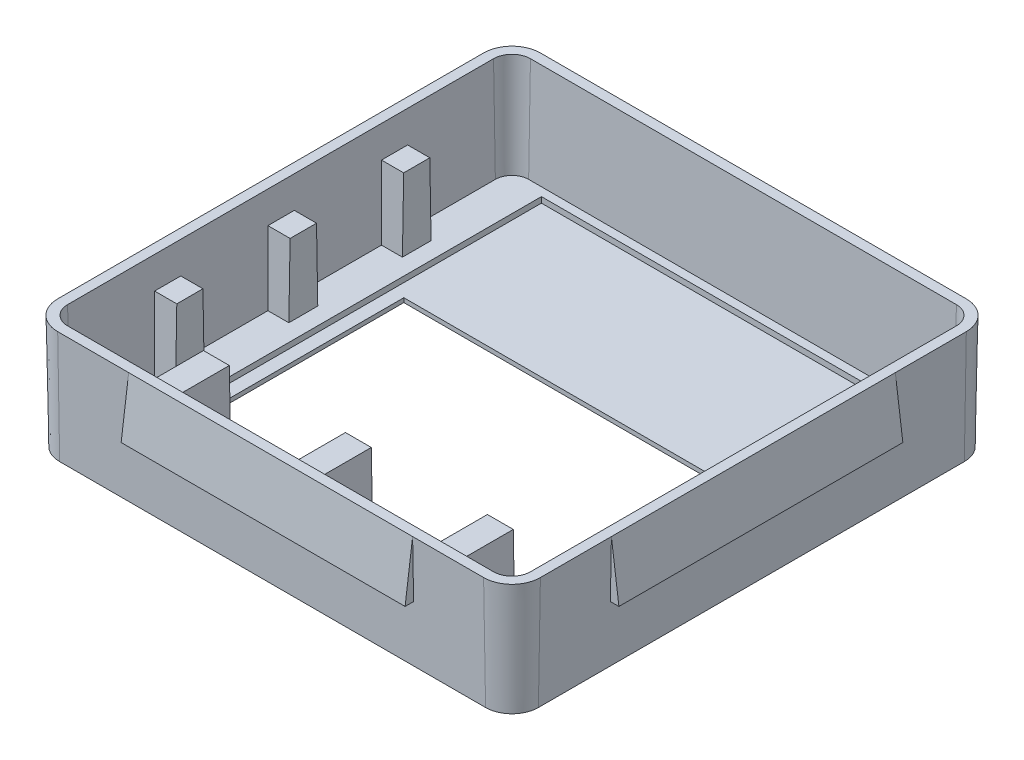
from build123d import *

# Parameters (mm, degrees)
BOSS_EXTRUDE1_DEPTH  = 4
BOSS_EXTRUDE1_DRAFT  = -1
SHELL1_T             = -0.35
SKETCH2_W            = 12.58
SKETCH2_H            = 6.98
CUT_EXTRUDE1_DEPTH   = 2
SKETCH3_W            = 13.5
SKETCH3_H            = 13.096235698
CUT_EXTRUDE2_DEPTH   = 0.2
BOSS_EXTRUDE3_REACH  = 20.425
BOSS_EXTRUDE4_REACH  = 20.425
LPATTERN2_COUNT      = 2
LPATTERN2_PITCH      = 4
MIRROR4_COPY_1_REACH = 20.425
MIRROR4_COPY_2_REACH = 20.425
LPATTERN3_COUNT      = 2
LPATTERN3_PITCH      = 4
MIRROR5_COPY_1_REACH = 20.425
MIRROR5_COPY_2_REACH = 20.425
BOSS_EXTRUDE5_REACH  = 18.785
LPATTERN4_COUNT      = 2
LPATTERN4_PITCH      = 5
MIRROR6_COPY_1_REACH = 18.785
MIRROR6_COPY_2_REACH = 18.785
BOSS_EXTRUDE6_DEPTH  = 5
BOSS_EXTRUDE7_DEPTH  = 5


with BuildPart() as part:
    # Sketch1 → Boss-Extrude1 (with draft: the straight prism first)
    with BuildSketch(Plane(origin=(0, 0, 0), x_dir=(1, 0, 0), z_dir=(0, 1, 0))):
        with BuildLine():
            Line((-7.5, -8.5), (7.5, -8.5))
            ThreePointArc((7.5, -8.5), (8.207106781, -8.207106781), (8.5, -7.5))
            Line((8.5, -7.5), (8.5, 7.5))
            ThreePointArc((8.5, 7.5), (8.207106781, 8.207106781), (7.5, 8.5))
            Line((7.5, 8.5), (-7.5, 8.5))
            ThreePointArc((-7.5, 8.5), (-8.207106781, 8.207106781), (-8.5, 7.5))
            Line((-8.5, 7.5), (-8.5, -7.5))
            ThreePointArc((-8.5, -7.5), (-8.207106781, -8.207106781), (-7.5, -8.5))
        make_face()
    extrude(amount=-BOSS_EXTRUDE1_DEPTH)
    # Boss-Extrude1: the draft: its side faces are tilted about the plane it starts from
    boss_extrude1_sides = [part.faces().sort_by_distance(p)[0] for p in [
        (0, -2, 8.5),
        (8.207106781, -2, 8.207106781),
        (8.5, -2, 0),
        (8.207106781, -2, -8.207106781),
        (0, -2, -8.5),
        (-8.207106781, -2, -8.207106781),
        (-8.5, -2, 0),
        (-8.207106781, -2, 8.207106781),
    ]]
    draft(boss_extrude1_sides, Plane(origin=(0, 0, 0), x_dir=(1, 0, 0), z_dir=(0, 1, 0)), BOSS_EXTRUDE1_DRAFT)

    # Shell1
    shell1_openings = [part.faces().sort_by_distance(p)[0] for p in [
        (0, 0, 0),
    ]]
    offset(amount=SHELL1_T, openings=shell1_openings, kind=Kind.INTERSECTION)

    # Sketch2 → Cut-Extrude1 (cut)
    with BuildSketch(Plane.XZ.offset(4)):
        with Locations((0, 1.01)):
            Rectangle(SKETCH2_W, SKETCH2_H)
    extrude(amount=-CUT_EXTRUDE1_DEPTH, mode=Mode.SUBTRACT)

    # Sketch3 → Cut-Extrude2 (cut)
    with BuildSketch(Plane(origin=(0, -3.65, 0), x_dir=(1, 0, 0), z_dir=(0, 1, 0))):
        with Locations((0, 1.238117849)):
            Rectangle(SKETCH3_W, SKETCH3_H)
    extrude(amount=-CUT_EXTRUDE2_DEPTH, mode=Mode.SUBTRACT)

    # Boss-Extrude3: up to this plane
    boss_extrude3_end = Plane(origin=(8.150053307, 0.006108342, 7.5), z_dir=(0.9998476951563913, -0.01745240643728355, 0))
    # Sketch11 → Boss-Extrude3 (add, up to the surface)
    with BuildSketch(Plane.ZY.offset(-7.35), mode=Mode.PRIVATE) as boss_extrude3_sk1:
        Polygon((-0.455489584, -1.1), (0.46508987, -1.1), (0.509600286, -3.65), (-0.5, -3.65), align=None)
    boss_extrude3_tool1 = split(extrude(boss_extrude3_sk1.sketch, amount=-BOSS_EXTRUDE3_REACH, mode=Mode.PRIVATE), bisect_by=boss_extrude3_end, keep=Keep.BOTH, mode=Mode.PRIVATE)
    boss_extrude3 = boss_extrude3_tool1.solids().sort_by_distance((7.35, -2.394601, 0.0048))[0]
    add(boss_extrude3)

    # Boss-Extrude4: up to this plane
    boss_extrude4_end = Plane(origin=(-8.150053307, 0.006108342, 7.5), z_dir=(-0.9998476951563913, -0.01745240643728355, 0))
    # Sketch13 → Boss-Extrude4 (add, up to the surface)
    with BuildSketch(Plane(origin=(-7.35, 0, 0), x_dir=(0, 0, -1), z_dir=(1, 0, 0)), mode=Mode.PRIVATE) as boss_extrude4_sk1:
        Polygon((-0.5, -3.65), (0.509600286, -3.65), (0.46508987, -1.1), (-0.455489584, -1.1), align=None)
    boss_extrude4_tool1 = split(extrude(boss_extrude4_sk1.sketch, amount=-BOSS_EXTRUDE4_REACH, mode=Mode.PRIVATE), bisect_by=boss_extrude4_end, keep=Keep.BOTH, mode=Mode.PRIVATE)
    boss_extrude4 = boss_extrude4_tool1.solids().sort_by_distance((-7.35, -2.394601, -0.0048))[0]
    add(boss_extrude4)

    # LPattern2: Boss-Extrude3 ×2
    with Locations(*[(0, 0, i * LPATTERN2_PITCH) for i in range(1, LPATTERN2_COUNT)]):
        add(boss_extrude3)

    # Mirror4 copy 1: up to this plane
    mirror4_copy_1_end = Plane(origin=(8.150053307, 0.006108342, 7.5), z_dir=(0.9998476951563913, -0.01745240643728355, 0))
    # Mirror4 copy 1 sketch → Mirror4 copy 1 (add, up to the surface)
    with BuildSketch(Plane(origin=(7.35, 0, -4), x_dir=(0, 0, -1), z_dir=(-1, 0, 0)), mode=Mode.PRIVATE) as mirror4_copy_1_sk1:
        Polygon((-0.455489584, 1.1), (0.46508987, 1.1), (0.509600286, 3.65), (-0.5, 3.65), align=None)
    mirror4_copy_1_tool1 = split(extrude(mirror4_copy_1_sk1.sketch, amount=-MIRROR4_COPY_1_REACH, mode=Mode.PRIVATE), bisect_by=mirror4_copy_1_end, keep=Keep.BOTH, mode=Mode.PRIVATE)
    add(mirror4_copy_1_tool1.solids().sort_by_distance((7.35, -2.394601, 0.0048))[0])

    # Mirror4 copy 2: up to this plane
    mirror4_copy_2_end = Plane(origin=(8.150053307, 0.006108342, 7.5), z_dir=(0.9998476951563913, -0.01745240643728355, 0))
    # Mirror4 copy 2 sketch → Mirror4 copy 2 (add, up to the surface)
    with BuildSketch(Plane(origin=(7.35, 0, 0), x_dir=(0, 0, -1), z_dir=(-1, 0, 0)), mode=Mode.PRIVATE) as mirror4_copy_2_sk1:
        Polygon((-0.455489584, 1.1), (0.46508987, 1.1), (0.509600286, 3.65), (-0.5, 3.65), align=None)
    mirror4_copy_2_tool1 = split(extrude(mirror4_copy_2_sk1.sketch, amount=-MIRROR4_COPY_2_REACH, mode=Mode.PRIVATE), bisect_by=mirror4_copy_2_end, keep=Keep.BOTH, mode=Mode.PRIVATE)
    add(mirror4_copy_2_tool1.solids().sort_by_distance((7.35, -2.394601, 0.0048))[0])

    # LPattern3: Boss-Extrude4 ×2
    with Locations(*[(0, 0, i * LPATTERN3_PITCH) for i in range(1, LPATTERN3_COUNT)]):
        add(boss_extrude4)

    # Mirror5 copy 1: up to this plane
    mirror5_copy_1_end = Plane(origin=(-8.150053307, 0.006108342, 7.5), z_dir=(-0.9998476951563913, -0.01745240643728355, 0))
    # Mirror5 copy 1 sketch → Mirror5 copy 1 (add, up to the surface)
    with BuildSketch(Plane(origin=(-7.35, 0, -4), x_dir=(0, 0, 1), z_dir=(1, 0, 0)), mode=Mode.PRIVATE) as mirror5_copy_1_sk1:
        Polygon((-0.5, 3.65), (0.509600286, 3.65), (0.46508987, 1.1), (-0.455489584, 1.1), align=None)
    mirror5_copy_1_tool1 = split(extrude(mirror5_copy_1_sk1.sketch, amount=-MIRROR5_COPY_1_REACH, mode=Mode.PRIVATE), bisect_by=mirror5_copy_1_end, keep=Keep.BOTH, mode=Mode.PRIVATE)
    add(mirror5_copy_1_tool1.solids().sort_by_distance((-7.35, -2.394601, -0.0048))[0])

    # Mirror5 copy 2: up to this plane
    mirror5_copy_2_end = Plane(origin=(-8.150053307, 0.006108342, 7.5), z_dir=(-0.9998476951563913, -0.01745240643728355, 0))
    # Mirror5 copy 2 sketch → Mirror5 copy 2 (add, up to the surface)
    with BuildSketch(Plane(origin=(-7.35, 0, 0), x_dir=(0, 0, 1), z_dir=(1, 0, 0)), mode=Mode.PRIVATE) as mirror5_copy_2_sk1:
        Polygon((-0.5, 3.65), (0.509600286, 3.65), (0.46508987, 1.1), (-0.455489584, 1.1), align=None)
    mirror5_copy_2_tool1 = split(extrude(mirror5_copy_2_sk1.sketch, amount=-MIRROR5_COPY_2_REACH, mode=Mode.PRIVATE), bisect_by=mirror5_copy_2_end, keep=Keep.BOTH, mode=Mode.PRIVATE)
    add(mirror5_copy_2_tool1.solids().sort_by_distance((-7.35, -2.394601, -0.0048))[0])

    # Boss-Extrude5: up to this plane
    boss_extrude5_end = Plane(origin=(-7.5, 0.006108342, 8.150053307), z_dir=(0, -0.017452406437283553, 0.9998476951563913))
    # Sketch16 → Boss-Extrude5 (add, up to the surface)
    with BuildSketch(Plane.XY.offset(5.41), mode=Mode.PRIVATE) as boss_extrude5_sk1:
        Polygon((-0.5, -3.65), (0.5, -3.65), (0.455489584, -1.1), (-0.455489584, -1.1), align=None)
    boss_extrude5_tool1 = split(extrude(boss_extrude5_sk1.sketch, amount=BOSS_EXTRUDE5_REACH, mode=Mode.PRIVATE), bisect_by=boss_extrude5_end, keep=Keep.BOTH, mode=Mode.PRIVATE)
    boss_extrude5 = boss_extrude5_tool1.solids().sort_by_distance((0, -2.394798, 5.41))[0]
    add(boss_extrude5)

    # LPattern4: Boss-Extrude5 ×2
    with Locations(*[(i * LPATTERN4_PITCH, 0, 0) for i in range(1, LPATTERN4_COUNT)]):
        add(boss_extrude5)

    # Mirror6 copy 1: up to this plane
    mirror6_copy_1_end = Plane(origin=(-7.5, 0.006108342, 8.150053307), z_dir=(0, -0.017452406437283553, 0.9998476951563913))
    # Mirror6 copy 1 sketch → Mirror6 copy 1 (add, up to the surface)
    with BuildSketch(Plane(origin=(-5, 0, 5.41), x_dir=(-1, 0, 0), z_dir=(0, 0, 1)), mode=Mode.PRIVATE) as mirror6_copy_1_sk1:
        Polygon((-0.5, 3.65), (0.5, 3.65), (0.455489584, 1.1), (-0.455489584, 1.1), align=None)
    mirror6_copy_1_tool1 = split(extrude(mirror6_copy_1_sk1.sketch, amount=MIRROR6_COPY_1_REACH, mode=Mode.PRIVATE), bisect_by=mirror6_copy_1_end, keep=Keep.BOTH, mode=Mode.PRIVATE)
    add(mirror6_copy_1_tool1.solids().sort_by_distance((0, -2.394798, 5.41))[0])

    # Mirror6 copy 2: up to this plane
    mirror6_copy_2_end = Plane(origin=(-7.5, 0.006108342, 8.150053307), z_dir=(0, -0.017452406437283553, 0.9998476951563913))
    # Mirror6 copy 2 sketch → Mirror6 copy 2 (add, up to the surface)
    with BuildSketch(Plane(origin=(0, 0, 5.41), x_dir=(-1, 0, 0), z_dir=(0, 0, 1)), mode=Mode.PRIVATE) as mirror6_copy_2_sk1:
        Polygon((-0.5, 3.65), (0.5, 3.65), (0.455489584, 1.1), (-0.455489584, 1.1), align=None)
    mirror6_copy_2_tool1 = split(extrude(mirror6_copy_2_sk1.sketch, amount=MIRROR6_COPY_2_REACH, mode=Mode.PRIVATE), bisect_by=mirror6_copy_2_end, keep=Keep.BOTH, mode=Mode.PRIVATE)
    add(mirror6_copy_2_tool1.solids().sort_by_distance((0, -2.394798, 5.41))[0])

    # Sketch17 → Boss-Extrude6 (add, symmetric)
    with BuildSketch(Plane.XY):
        Polygon((-8.5, 0), (-8.46508987, -2), (-8.76508987, -2), align=None)
        Polygon((8.76508987, -2), (8.5, 0), (8.46508987, -2), align=None)
    extrude(amount=BOSS_EXTRUDE6_DEPTH, both=True)

    # Sketch18 → Boss-Extrude7 (add, symmetric)
    with BuildSketch(Plane(origin=(0, 0, 0), x_dir=(0, 0, -1), z_dir=(1, 0, 0))):
        Polygon((8.5, 0), (8.46508987, -2), (8.76508987, -2), align=None)
        Polygon((-8.76508987, -2), (-8.5, 0), (-8.46508987, -2), align=None)
    extrude(amount=BOSS_EXTRUDE7_DEPTH, both=True)


solid = part.part
